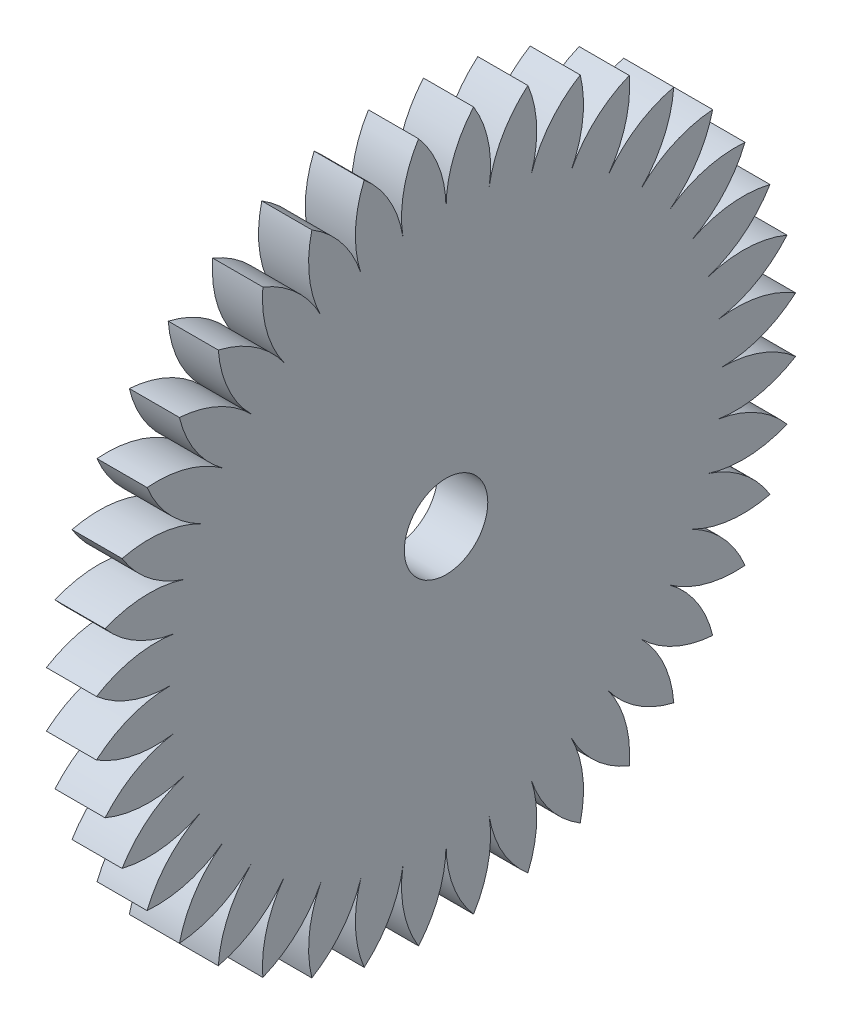
from build123d import *

# Parameters (mm, degrees)
BOSS_EXTRUDE1_DEPTH = 3
CIRPATTERN1_COUNT   = 40
SKETCH2_R           = 2.5
CUT_EXTRUDE2_DEPTH  = 30.758537568


with BuildPart() as part:
    # Sketch1 → Boss-Extrude1 (new body)
    with BuildSketch(Plane(origin=(0, 0, 0), x_dir=(0, 0, -1), z_dir=(1, 0, 0))):
        with BuildLine():
            ThreePointArc((1.64764101, 20.935264008), (0.425217975, 18.865707491), (0, 16.5))
            Line((0, 16.5), (0, 0))
            Line((0, 0), (2.581168673, 16.29685762))
            ThreePointArc((2.581168673, 16.29685762), (2.531264023, 18.699958072), (1.64764101, 20.935264008))
        make_face()
    boss_extrude1 = extrude(amount=BOSS_EXTRUDE1_DEPTH)

    # CirPattern1: Boss-Extrude1 ×40 about axis
    cirpattern1_axis = Axis((3, 0, 0), (-1, 0, 0))
    for i in range(1, CIRPATTERN1_COUNT):
        add(boss_extrude1.rotate(cirpattern1_axis, i * 360 / CIRPATTERN1_COUNT))

    # Sketch2 → Cut-Extrude2 (cut, through all)
    with BuildSketch(Plane(origin=(0, 0, 0), x_dir=(0, 0, -1), z_dir=(1, 0, 0))):
        Circle(SKETCH2_R)
    extrude(amount=CUT_EXTRUDE2_DEPTH, mode=Mode.SUBTRACT)


solid = part.part
